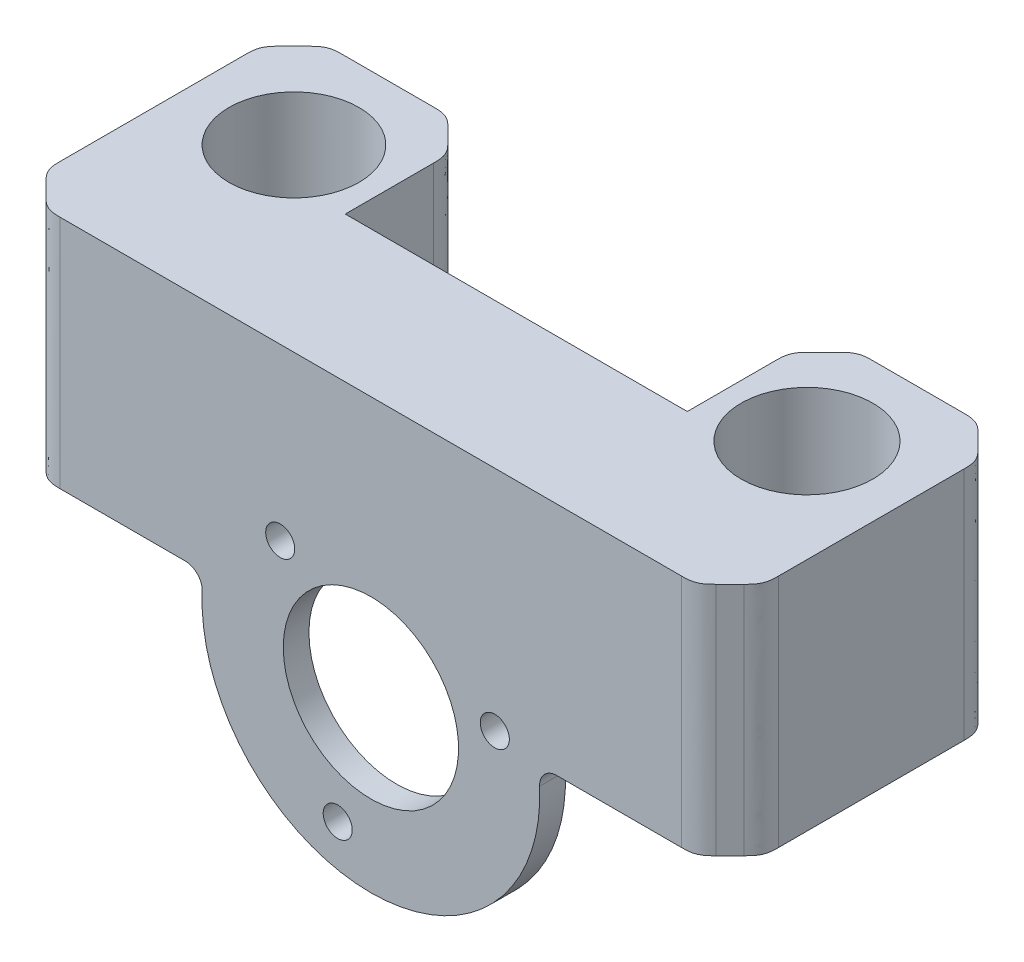
from build123d import *

# Parameters (mm, degrees)
ESQUISSE1_R             = 7.6
BOSS_EXTRU_1_DEPTH      = 25
ESQUISSE3_R             = 7.6
ESQUISSE3_R_2           = 4.4
BOSS_EXTRU_3_DEPTH      = 2.5
BOSS_EXTRU_3_2_DEPTH    = 2.5
BOSS_EXTRU_5_START      = -2.5
ESQUISSE1_4_R           = 7.6
BOSS_EXTRU_5_DEPTH      = 2.5
ESQUISSE7_R             = 19.75
ESQUISSE7_R_2           = 1.7
ESQUISSE7_R_3           = 10.25
ENL_V_MAT_EXTRU_1_DEPTH = 14
BOSS_EXTRU_9_START      = -3
BOSS_EXTRU_9_DEPTH      = 3
ESQUISSE7_4_R           = 1.7
ENL_V_MAT_EXTRU_2_DEPTH = 52.87063246
ENL_V_START             = -24
ESQUISSE11_R            = 7.6
ESQUISSE11_R_2          = 7.7
ENL_V_MAT_EXTRU_3_DEPTH = 24
CONG_2_R                = 2


with BuildPart() as part:
    # Esquisse1 → Boss.-Extru.1 (new body)
    with BuildSketch(Plane(origin=(0, 0, 0), x_dir=(1, 0, 0), z_dir=(0, 1, 0))):
        Polygon((-26, -21), (26, -21), (38, -21), (42, -17), (42, 0), (42, 8), (38, 12), (24, 12), (20, 8), (20, 1), (20, -4), (17, -4), (-17, -4), (-20, -4), (-20, 1), (-20, 8), (-24, 12), (-38, 12), (-42, 8), (-42, 0), (-42, -17), (-38, -21), align=None)
        with Locations(Location((-30, 0, 0), (0, 0, 270))):
            Circle(ESQUISSE1_R, mode=Mode.SUBTRACT)
        with Locations(Location((30, 0, 0), (0, 0, 90))):
            Circle(ESQUISSE1_R, mode=Mode.SUBTRACT)
    extrude(amount=BOSS_EXTRU_1_DEPTH)


with BuildPart() as body_2:
    # Esquisse3 → Boss.-Extru.3 (new body)
    with BuildSketch(Plane.XZ):
        with Locations(Location((-30, 0, 0), (0, 0, 90))):
            Circle(ESQUISSE3_R)
        with Locations(Location((-30, 0, 0), (0, 0, 270))):
            Circle(ESQUISSE3_R_2, mode=Mode.SUBTRACT)
    extrude(amount=BOSS_EXTRU_3_DEPTH)


with BuildPart() as body_3:
    # Esquisse3 → Boss.-Extru.3 2 (new body)
    with BuildSketch(Plane.XZ):
        with Locations(Location((30, 0, 0), (0, 0, 270))):
            Circle(ESQUISSE3_R)
        with Locations(Location((30, 0, 0), (0, 0, 90))):
            Circle(ESQUISSE3_R_2, mode=Mode.SUBTRACT)
    extrude(amount=BOSS_EXTRU_3_2_DEPTH)


with BuildPart() as boss_extru_5_tool:
    # Esquisse1<4> → Boss.-Extru.5 (new body)
    with BuildSketch(Plane(origin=(0, 0, 0), x_dir=(1, 0, 0), z_dir=(0, 1, 0)).offset(BOSS_EXTRU_5_START)):
        Polygon((-26, -21), (26, -21), (38, -21), (42, -17), (42, 0), (42, 8), (38, 12), (24, 12), (20, 8), (20, 1), (20, -4), (17, -4), (-17, -4), (-20, -4), (-20, 1), (-20, 8), (-24, 12), (-38, 12), (-42, 8), (-42, 0), (-42, -17), (-38, -21), align=None)
        with Locations(Location((-30, 0, 0), (0, 0, 90))):
            Circle(ESQUISSE1_4_R, mode=Mode.SUBTRACT)
        with Locations(Location((30, 0, 0), (0, 0, 90))):
            Circle(ESQUISSE1_4_R, mode=Mode.SUBTRACT)
    extrude(amount=BOSS_EXTRU_5_DEPTH)


with BuildPart() as part_1:
    add(part.part)


with BuildPart() as part_2:
    # Boss.-Extru.5: joined with boss_extru_5_tool
    add(part_1.part.fuse(boss_extru_5_tool.part, body_2.part, body_3.part, tol=0.00001))

    # Congé1
    # a fillet whose section is not a circle: 4 mm, written as the material it takes off along each edge
    with BuildSketch(Plane(origin=(-42, 29.142135624, 17), x_dir=(0, 0, -1), z_dir=(0, -1, 0)), Plane(origin=(-38, -6.642135624, -12), x_dir=(-0.707106781186547, 0, 0.7071067811865481), z_dir=(0, 1, 0)), Plane(origin=(-24, -6.642135624, -12), x_dir=(-1, 0, 0), z_dir=(0, 1, 0)), Plane(origin=(-20, -6.642135624, -8), x_dir=(-0.707106781186547, 0, -0.7071067811865481), z_dir=(0, 1, 0)), Plane(origin=(42, -6.642135624, 17), x_dir=(0, 0, -1), z_dir=(0, 1, 0)), Plane(origin=(42, -6.642135624, -8), x_dir=(-0.7071067811865487, 0, -0.7071067811865465), z_dir=(0, 1, 0)), Plane(origin=(38, -6.642135624, -12), x_dir=(-1, 0, 0), z_dir=(0, 1, 0)), Plane(origin=(24, -6.642135624, -12), x_dir=(-0.7071067811865459, 0, 0.7071067811865491), z_dir=(0, 1, 0)), Plane(origin=(20, -6.642135624, -8), x_dir=(0, 0, 1), z_dir=(0, 1, 0))) as cong_1_piece_1:
        with BuildLine():
            add(Edge.make_bspline([(1.656854249, 0), (1.35356905, 0), (1.050283851, 0), (0.373674798, 0.056927592), (-0.223974097, 0.30448187), (-0.742662833, 0.742662833), (-0.957117854, 0.957117854), (-1.171572875, 1.171572875)], knots=[0, 0, 0, 0, 0, 0, 0.5, 0.5, 1, 1, 1, 1, 1, 1], degree=5))
            Line((-1.171572875, 1.171572875), (0, 0))
            Line((0, 0), (1.656854249, 0))
        make_face()
    extrude(amount=35.784271247, mode=Mode.SUBTRACT)
    with BuildSketch(Plane(origin=(-42, 29.142135624, -8), x_dir=(0, 0, 1), z_dir=(0, -1, 0)), Plane(origin=(-38, 29.142135624, 21), x_dir=(1, 0, 0), z_dir=(0, -1, 0)), Plane(origin=(38, -6.642135624, 21), x_dir=(-1, 0, 0), z_dir=(0, 1, 0))) as cong_1_piece_2:
        with BuildLine():
            add(Edge.make_bspline([(1.656854249, 0), (1.35356905, 0), (1.050283851, 0), (0.373674798, -0.056927592), (-0.223974097, -0.30448187), (-0.742662833, -0.742662833), (-0.957117854, -0.957117854), (-1.171572875, -1.171572875)], knots=[0, 0, 0, 0, 0, 0, 0.5, 0.5, 1, 1, 1, 1, 1, 1], degree=5))
            Line((-1.171572875, -1.171572875), (0, 0))
            Line((0, 0), (1.656854249, 0))
        make_face()
    extrude(amount=35.784271247, mode=Mode.SUBTRACT)

    # Esquisse7 → Enlèv. mat.-Extru.1 (cut)
    with BuildSketch(Plane(origin=(0, 0, 4), x_dir=(-1, 0, 0), z_dir=(0, 0, -1))):
        with Locations((0, -5.5)):
            Circle(ESQUISSE7_R)
        with Locations((-14.488887394, -1.617714323)):
            Circle(ESQUISSE7_R_2, mode=Mode.SUBTRACT)
        with Locations((10.606601718, 5.106601718)):
            Circle(ESQUISSE7_R_2, mode=Mode.SUBTRACT)
        with Locations((3.882285677, -19.988887394)):
            Circle(ESQUISSE7_R_2, mode=Mode.SUBTRACT)
        with Locations((0, -5.5)):
            Circle(ESQUISSE7_R_3, mode=Mode.SUBTRACT)
        with Locations((-9.899494937, -15.399494937)):
            Circle(ESQUISSE7_R_2, mode=Mode.SUBTRACT)
    extrude(amount=-ENL_V_MAT_EXTRU_1_DEPTH, mode=Mode.SUBTRACT)

    # Esquisse10 → Boss.-Extru.9 (add)
    with BuildSketch(Plane.XY.offset(21).offset(BOSS_EXTRU_9_START)):
        with BuildLine():
            Line((19.520822216, -2.5), (-19.520822216, -2.5))
            ThreePointArc((-19.520822216, -2.5), (0, -25.25), (19.520822216, -2.5))
        make_face()
    extrude(amount=BOSS_EXTRU_9_DEPTH)

    # Esquisse7<4> → Enlèv. mat.-Extru.2 (cut, through all)
    with BuildSketch(Plane(origin=(0, 0, 4), x_dir=(-1, 0, 0), z_dir=(0, 0, -1))):
        with Locations((3.882285677, -19.988887394)):
            Circle(ESQUISSE7_4_R)
        with Locations((-14.488887394, -1.617714323)):
            Circle(ESQUISSE7_4_R)
        with Locations((10.606601718, 5.106601718)):
            Circle(ESQUISSE7_4_R)
        with BuildLine():
            Line((-9.801147892, -2.5), (9.801147892, -2.5))
            ThreePointArc((9.801147892, -2.5), (0, 4.75), (-9.801147892, -2.5))
        make_face()
        with BuildLine():
            ThreePointArc((10.25, -5.5), (10.137165923, -3.983303902), (9.801147892, -2.5))
            Line((9.801147892, -2.5), (-9.801147892, -2.5))
            ThreePointArc((-9.801147892, -2.5), (-1.516696098, -15.637165923), (10.25, -5.5))
        make_face()
    extrude(amount=-ENL_V_MAT_EXTRU_2_DEPTH, mode=Mode.SUBTRACT)

    # Esquisse11 → Enlèv. mat.-Extru.3 (cut)
    with BuildSketch(Plane(origin=(0, 25, 0), x_dir=(1, 0, 0), z_dir=(0, 1, 0)).offset(ENL_V_START)):
        with Locations(Location((-30, 0, 0), (0, 0, 90))):
            Circle(ESQUISSE11_R)
        with Locations(Location((30, 0, 0), (0, 0, 270))):
            Circle(ESQUISSE11_R_2)
    extrude(amount=ENL_V_MAT_EXTRU_3_DEPTH, mode=Mode.SUBTRACT)

    # Congé2
    cong_2_edges = [part_2.edges().sort_by_distance(p)[0] for p in [
        (-19.520822216, -2.5, 19.5),
        (19.520822216, -2.5, 19.5),
    ]]
    fillet(cong_2_edges, radius=CONG_2_R)


solid = part_2.part
